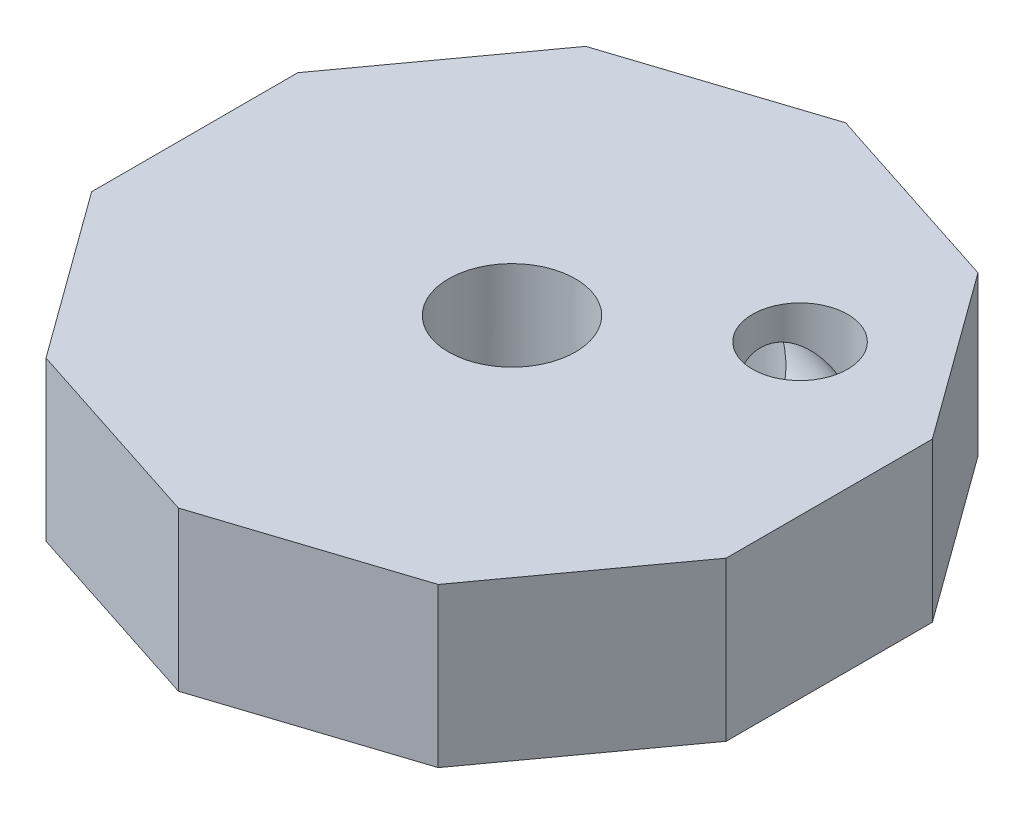
from build123d import *

# Parameters (mm, degrees)
BOSS_EXTRUDE1_DEPTH = 5
SKETCH2_R           = 1.5
SKETCH2_R_2         = 2
CUT_EXTRUDE1_DEPTH  = 5
SKETCH4_R           = 3
CUT_EXTRUDE2_DEPTH  = 1.5
SKETCH11_R          = 1.5
SKETCH17_R          = 1.5


with BuildPart() as part:
    # Sketch1 → Boss-Extrude1 (new body)
    with BuildSketch(Plane(origin=(0, 0, 0), x_dir=(1, 0, 0), z_dir=(0, 1, 0))):
        Polygon((6.180339887, -8.506508084), (10, -3.249196962), (10, 3.249196962), (6.180339887, 8.506508084), (0, 10.514622242), (-6.180339887, 8.506508084), (-10, 3.249196962), (-10, -3.249196962), (-6.180339887, -8.506508084), (0, -10.514622242), align=None)
    extrude(amount=BOSS_EXTRUDE1_DEPTH)

    # Sketch2 → Cut-Extrude1 (cut)
    with BuildSketch(Plane(origin=(0, 5, 0), x_dir=(1, 0, 0), z_dir=(0, 1, 0))):
        with Locations((5.258610463, 3.82060414)):
            Circle(SKETCH2_R)
        Circle(SKETCH2_R_2)
    extrude(amount=-CUT_EXTRUDE1_DEPTH, mode=Mode.SUBTRACT)

    # Sketch4 → Cut-Extrude2 (cut)
    with BuildSketch(Plane.XZ):
        Circle(SKETCH4_R)
    extrude(amount=-CUT_EXTRUDE2_DEPTH, mode=Mode.SUBTRACT)

    # Cut-Sweep5: sweep along a path in Sketch12
    with BuildLine(Plane(origin=(1.625, 0, -5.001235748), x_dir=(-0.9510565162951587, 0, -0.30901699437493163), z_dir=(0.30901699437493163, 0, -0.9510565162951587))) as cut_sweep5_path:
        Line((0.17939586, 0), (0.17939586, 2.499199175))
        Line((0.17939586, 2.499199175), (-3.82060414, 2.499199175))
    # Sketch11 → Cut-Sweep5 (sweep, cut)
    with BuildSketch(Plane.XZ):
        with Locations((1.454384398, -5.056672117)):
            Circle(SKETCH11_R)
    sweep(path=cut_sweep5_path.line, transition=Transition.RIGHT, mode=Mode.SUBTRACT)

    # Cut-Sweep6: sweep along a path in Sketch18
    with BuildLine(Plane.ZY.offset(-5.258610463)) as cut_sweep6_path:
        Line((0.17939586, 0), (0.17939586, 2.5))
        Line((0.17939586, 2.5), (-3.82060414, 2.5))
    # Sketch17 → Cut-Sweep6 (sweep, cut)
    with BuildSketch(Plane.XZ):
        with Locations((5.258610463, 0.17939586)):
            Circle(SKETCH17_R)
    sweep(path=cut_sweep6_path.line, transition=Transition.RIGHT, mode=Mode.SUBTRACT)


solid = part.part
